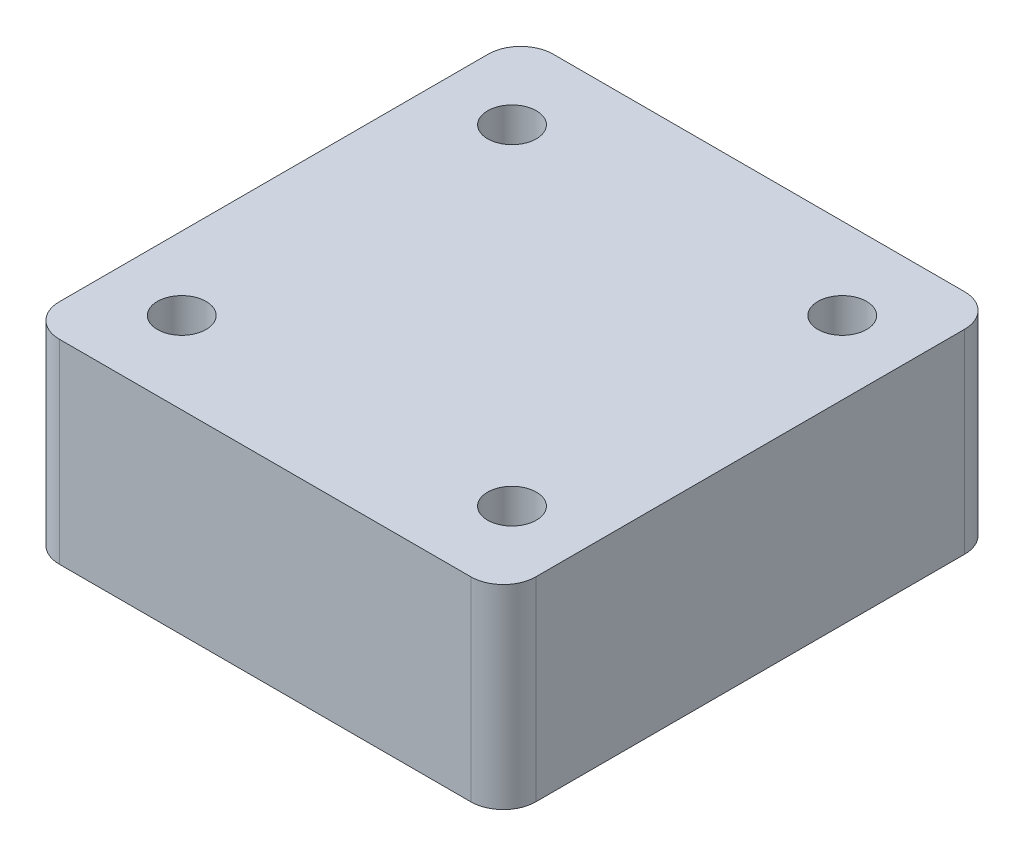
from build123d import *

# Parameters (mm, degrees)
SKETCH1_W            = 44
SKETCH1_H            = 45.6
BOSS_EXTRUDE1_DEPTH  = 18
FILLET1_R            = 3
M4_CLEARANCE_HOLE1_D = 4.5


with BuildPart() as part:
    # Sketch1 → Boss-Extrude1 (new body)
    with BuildSketch(Plane(origin=(0, 0, 0), x_dir=(1, 0, 0), z_dir=(0, 1, 0))):
        Rectangle(SKETCH1_W, SKETCH1_H)
    extrude(amount=BOSS_EXTRUDE1_DEPTH)

    # Fillet1
    fillet1_edges = [part.edges().sort_by_distance(p)[0] for p in [
        (-22, 9, -22.8),
        (22, 9, -22.8),
        (22, 9, 22.8),
        (-22, 9, 22.8),
    ]]
    fillet(fillet1_edges, radius=FILLET1_R)

    # M4 Clearance Hole1 (through all)
    with Locations(Plane(origin=(0, 18, 0), x_dir=(1, 0, 0), z_dir=(0, 1, 0))):
        with Locations((15.25, -15.25), (-15.25, 15.25), (-15.25, -15.25), (15.25, 15.25)):
            Hole(M4_CLEARANCE_HOLE1_D / 2)


solid = part.part
